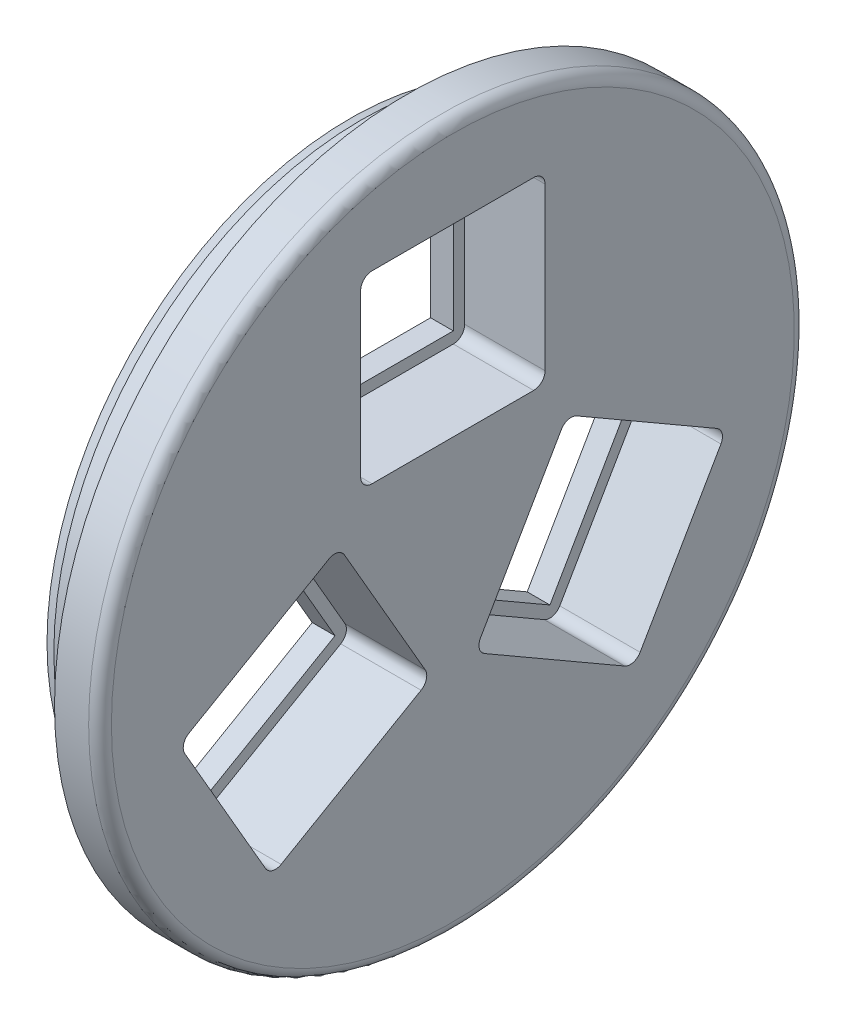
from build123d import *

# Parameters (mm, degrees)
CUT_EXTRUDE2_START = -10
CUT_EXTRUDE2_DEPTH = 214.834961543
CUT_EXTRUDE3_DEPTH = 224.834961543


with BuildPart() as part:
    # Çizim1 → Döndür1 (revolve)
    with BuildSketch(Plane.XY):
        with BuildLine():
            Line((0, 31), (5, 31))
            Line((5, 31), (5, 32.75))
            Line((5, 32.75), (7.3, 32.75))
            Line((7.3, 32.75), (7.3, 31))
            Line((7.3, 31), (25.3, 31))
            Line((25.3, 31), (25.3, 16))
            Line((25.3, 16), (35.3, 16))
            Line((35.3, 16), (35.3, 0))
            Line((35.3, 0), (45.3, 0))
            Line((45.3, 0), (45.3, 148.5))
            Line((45.3, 148.5), (45.3, 150))
            ThreePointArc((45.3, 150), (43.835533906, 153.535533906), (40.3, 155))
            Line((40.3, 155), (25.3, 155))
            Line((25.3, 155), (25.3, 135))
            Line((25.3, 135), (5, 135))
            Line((5, 135), (0, 133))
            Line((0, 133), (0, 31))
        make_face()
    revolve(axis=Axis((0, 0, 0), (1, 0, 0)))

    # Sketch2 → Cut-Extrude2 (cut, through all)
    with BuildSketch(Plane.ZY.offset(CUT_EXTRUDE2_START)):
        with BuildLine():
            Line((-35.5, 34.5), (0, 34.5))
            Line((0, 34.5), (35.5, 34.5))
            ThreePointArc((35.5, 34.5), (39.035533906, 35.964466094), (40.5, 39.5))
            Line((40.5, 39.5), (40.5, 110.5))
            ThreePointArc((40.5, 110.5), (39.035533906, 114.035533906), (35.5, 115.5))
            Line((35.5, 115.5), (-35.5, 115.5))
            ThreePointArc((-35.5, 115.5), (-39.035533906, 114.035533906), (-40.5, 110.5))
            Line((-40.5, 110.5), (-40.5, 39.5))
            ThreePointArc((-40.5, 39.5), (-39.035533906, 35.964466094), (-35.5, 34.5))
        make_face()
        with BuildLine():
            ThreePointArc((117.775934137, -27.006098166), (118.27543625, -23.21200294), (115.945807118, -20.175971147))
            Line((115.945807118, -20.175971147), (54.458003449, 15.324028853))
            ThreePointArc((54.458003449, 15.324028853), (50.663908224, 15.823530966), (47.627876431, 13.493901834))
            Line((47.627876431, 13.493901834), (12.127876431, -47.993901834))
            ThreePointArc((12.127876431, -47.993901834), (11.628374318, -51.78799706), (13.958003449, -54.824028853))
            Line((13.958003449, -54.824028853), (75.445807118, -90.324028853))
            ThreePointArc((75.445807118, -90.324028853), (79.239902344, -90.823530966), (82.275934137, -88.493901834))
            Line((82.275934137, -88.493901834), (117.775934137, -27.006098166))
        make_face()
        with BuildLine():
            ThreePointArc((-82.275934137, -88.493901834), (-79.239902344, -90.823530966), (-75.445807118, -90.324028853))
            Line((-75.445807118, -90.324028853), (-13.958003449, -54.824028853))
            ThreePointArc((-13.958003449, -54.824028853), (-11.628374318, -51.78799706), (-12.127876431, -47.993901834))
            Line((-12.127876431, -47.993901834), (-47.627876431, 13.493901834))
            ThreePointArc((-47.627876431, 13.493901834), (-50.663908224, 15.823530966), (-54.458003449, 15.324028853))
            Line((-54.458003449, 15.324028853), (-115.945807118, -20.175971147))
            ThreePointArc((-115.945807118, -20.175971147), (-118.27543625, -23.21200294), (-117.775934137, -27.006098166))
            Line((-117.775934137, -27.006098166), (-82.275934137, -88.493901834))
        make_face()
    extrude(amount=-CUT_EXTRUDE2_DEPTH, mode=Mode.SUBTRACT)

    # Sketch4 → Cut-Extrude3 (cut, through all)
    with BuildSketch(Plane.ZY):
        Polygon((77.945807118, -85.993901834), (113.445807118, -24.506098166), (51.958003449, 10.993901834), (16.458003449, -50.493901834), align=None)
        Polygon((35.5, 110.5), (-35.5, 110.5), (-35.5, 39.5), (0, 39.5), (35.5, 39.5), align=None)
        Polygon((-113.445807118, -24.506098166), (-77.945807118, -85.993901834), (-16.458003449, -50.493901834), (-51.958003449, 10.993901834), align=None)
    extrude(amount=-CUT_EXTRUDE3_DEPTH, mode=Mode.SUBTRACT)


solid = part.part
